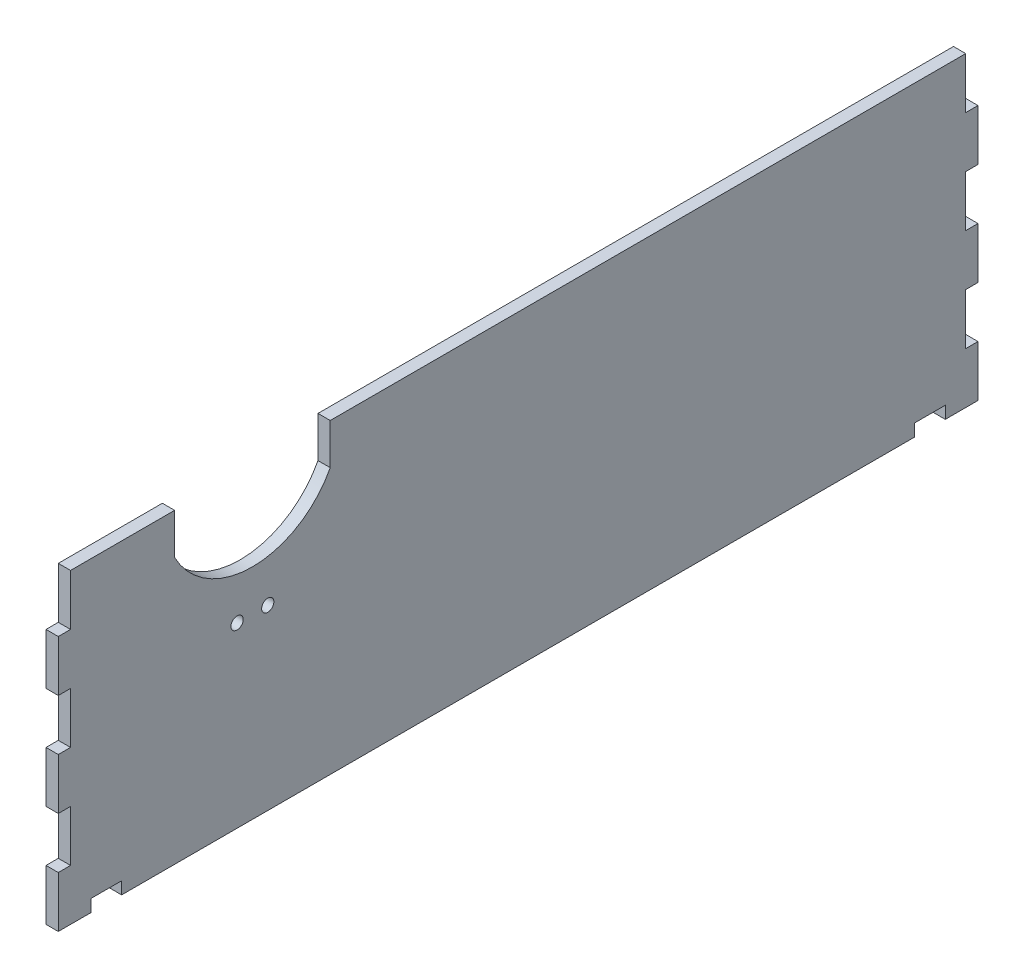
from build123d import *

# Parameters (mm, degrees)
SKETCH1_W            = 450
SKETCH1_H            = 150
BOSS_EXTRUDE1_DEPTH  = 6
SKETCH2_W            = 6
SKETCH2_H            = 25
CUT_EXTRUDE1_DEPTH   = 475.379594839
LPATTERN1_COUNT      = 3
LPATTERN1_PITCH      = 50
LPATTERN1_COUNT_DIR2 = 2
LPATTERN1_PITCH_DIR2 = 444
SKETCH3_W            = 15
SKETCH3_H            = 6
CUT_EXTRUDE2_DEPTH   = 475.379594839
LPATTERN2_COUNT      = 2
LPATTERN2_PITCH      = 403
SKETCH4_R            = 3
CUT_EXTRUDE3_DEPTH   = 10


with BuildPart() as part:
    # Sketch1 → Boss-Extrude1 (new body)
    with BuildSketch(Plane(origin=(0, 0, 0), x_dir=(0, 0, -1), z_dir=(1, 0, 0))):
        with Locations((-225, 75)):
            Rectangle(SKETCH1_W, SKETCH1_H)
    extrude(amount=BOSS_EXTRUDE1_DEPTH)

    # Sketch2 → Cut-Extrude1 (cut, through all)
    with BuildSketch(Plane(origin=(6, 0, 0), x_dir=(0, 0, -1), z_dir=(1, 0, 0))):
        with Locations((-447, 137.5)):
            Rectangle(SKETCH2_W, SKETCH2_H)
    cut_extrude1 = extrude(amount=-CUT_EXTRUDE1_DEPTH, mode=Mode.SUBTRACT)

    # LPattern1: Cut-Extrude1 3 × 2
    with Locations(*[(0, -i * LPATTERN1_PITCH, -j * LPATTERN1_PITCH_DIR2) for i in range(LPATTERN1_COUNT) for j in range(LPATTERN1_COUNT_DIR2) if (i, j) != (0, 0)]):
        add(cut_extrude1, mode=Mode.SUBTRACT)

    # Sketch3 → Cut-Extrude2 (cut, through all)
    with BuildSketch(Plane(origin=(6, 0, 0), x_dir=(0, 0, -1), z_dir=(1, 0, 0))):
        with Locations((-426.5, 3)):
            Rectangle(SKETCH3_W, SKETCH3_H)
    cut_extrude2 = extrude(amount=-CUT_EXTRUDE2_DEPTH, mode=Mode.SUBTRACT)

    # LPattern2: Cut-Extrude2 ×2
    with Locations(*[(0, 0, -i * LPATTERN2_PITCH) for i in range(1, LPATTERN2_COUNT)]):
        add(cut_extrude2, mode=Mode.SUBTRACT)

    # Sketch4 → Cut-Extrude3 (cut)
    with BuildSketch(Plane(origin=(6, 0, 0), x_dir=(0, 0, -1), z_dir=(1, 0, 0))):
        with Locations((-362.5, 87)):
            Circle(SKETCH4_R)
        with Locations((-347.5, 87)):
            Circle(SKETCH4_R)
        with BuildLine():
            Line((-393.065732621, 130), (-393.065732621, 150))
            Line((-393.065732621, 150), (-316.934267379, 150))
            Line((-316.934267379, 150), (-316.934267379, 130))
            ThreePointArc((-316.934267379, 130), (-355, 107), (-393.065732621, 130))
        make_face()
    extrude(amount=-CUT_EXTRUDE3_DEPTH, mode=Mode.SUBTRACT)


solid = part.part
